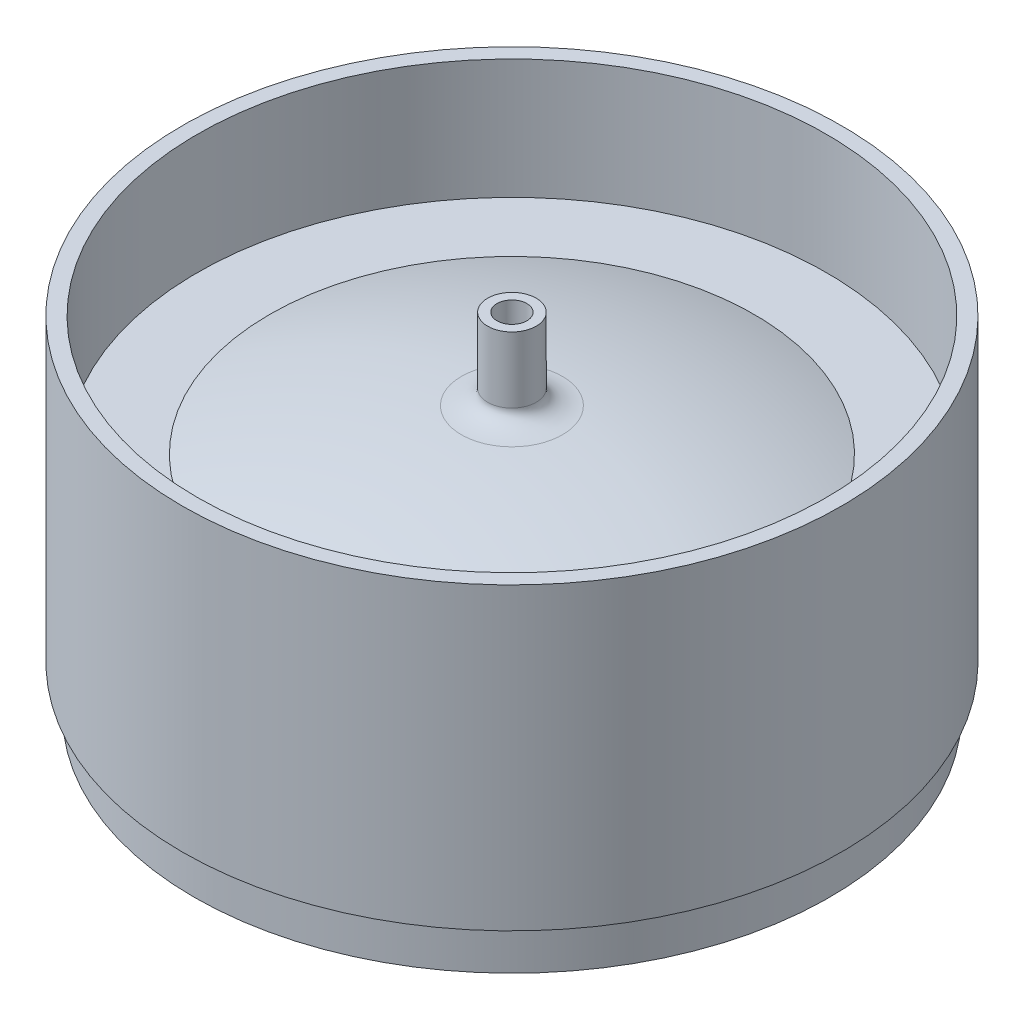
from build123d import *


with BuildPart() as part:
    # Sketch1 → Revolve1 (revolve)
    with BuildSketch(Plane.XY):
        with BuildLine():
            Line((-69.85, 9.525), (-69.85, 73.025))
            Line((-69.85, 73.025), (-66.675, 73.025))
            Line((-66.675, 73.025), (-66.675, 47.625))
            Line((-66.675, 47.625), (-51.343091672, 47.625))
            ThreePointArc((-51.343091672, 47.625), (-31.348788796, 53.543117841), (-10.715482107, 56.55358647))
            add(Edge.make_bspline(
                [(-5.1435, 59.72858647), (-5.1435, 57.45991268), (-8.517933143, 56.715253242), (-10.715482107, 56.55358647)],
                knots=[0, 0, 0, 0, 1, 1, 1, 1], degree=3))
            Line((-5.1435, 59.72858647), (-5.1435, 73.69858647))
            Line((-5.1435, 73.69858647), (-3.175, 73.69858647))
            Line((-3.175, 73.69858647), (-3.175, 50.561122579))
            ThreePointArc((-3.175, 50.561122579), (-27.690740484, 47.825337172), (-51.343091672, 40.820172182))
            ThreePointArc((-51.343091672, 40.820172182), (-60.094186985, 33.816180435), (-63.391760989, 23.103404173))
            Line((-63.391760989, 23.103404173), (-65.786, 9.525))
            Line((-65.786, 9.525), (-65.786, 0))
            Line((-65.786, 0), (-67.3735, 0))
            Line((-67.3735, 0), (-67.3735, 9.525))
            Line((-67.3735, 9.525), (-69.85, 9.525))
        make_face()
    revolve(axis=Axis((0, 127.060987048, 0), (0, -1, 0)))


solid = part.part
